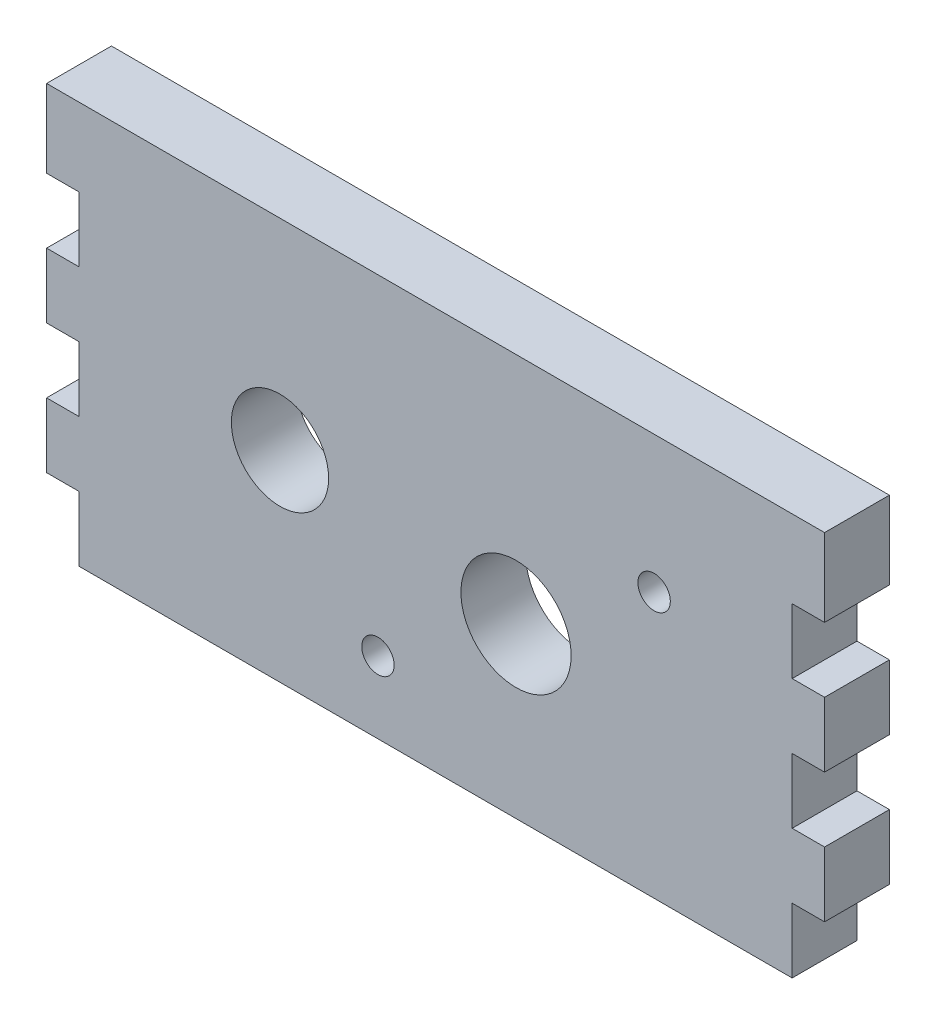
from build123d import *

# Parameters (mm, degrees)
SKETCH_2_W               = 120
SKETCH_2_H               = 62
SKETCH_2_R               = 2.5
SKETCH_2_R_2             = 8.5
SKETCH_2_R_3             = 7.5
EXTRUDE_1_DEPTH          = 10
CUT_EXTRUDE_1_REACH      = 70.272
SKETCH_3_W               = 5
SKETCH_3_H               = 10
PATTERN_LINEAR_1_COUNT   = 3
PATTERN_LINEAR_1_PITCH   = 20
MIRROR_1_COPY_1_REACH    = 70.272
MIRROR_1_COPY_1_SKETCH_W = 5
MIRROR_1_COPY_1_SKETCH_H = 10
MIRROR_1_COPY_2_REACH    = 70.272
MIRROR_1_COPY_2_SKETCH_W = 5
MIRROR_1_COPY_2_SKETCH_H = 10
MIRROR_1_COPY_3_REACH    = 70.272
MIRROR_1_COPY_3_SKETCH_W = 5
MIRROR_1_COPY_3_SKETCH_H = 10


with BuildPart() as part:
    # 스케치2 → 보스-돌출1 (new body)
    with BuildSketch(Plane.XY):
        Rectangle(SKETCH_2_W, SKETCH_2_H)
        with Locations((-8.889677969, -19.912987345)):
            Circle(SKETCH_2_R, mode=Mode.SUBTRACT)
        with Locations((12.408275183, -5)):
            Circle(SKETCH_2_R_2, mode=Mode.SUBTRACT)
        with Locations((-24, 0)):
            Circle(SKETCH_2_R_3, mode=Mode.SUBTRACT)
        with Locations((33.706228335, 9.912987345)):
            Circle(SKETCH_2_R, mode=Mode.SUBTRACT)
    extrude(amount=EXTRUDE_1_DEPTH)

    # 스케치3 → 컷-돌출1 (cut, up to next)
    with BuildSketch(Plane.XY.offset(10), mode=Mode.PRIVATE) as cut_extrude_1_sk1:
        with Locations((-57.5, -26)):
            Rectangle(SKETCH_3_W, SKETCH_3_H)
    cut_extrude_1_tool1 = extrude(cut_extrude_1_sk1.sketch, amount=-CUT_EXTRUDE_1_REACH, mode=Mode.PRIVATE) & part.part
    cut_extrude_1 = cut_extrude_1_tool1.solids().sort_by_distance((-57.5, -26, 10))[0]
    add(cut_extrude_1, mode=Mode.SUBTRACT)

    # 선형 패턴1: 컷-돌출1 ×3
    with Locations(*[(0, i * PATTERN_LINEAR_1_PITCH, 0) for i in range(1, PATTERN_LINEAR_1_COUNT)]):
        add(cut_extrude_1, mode=Mode.SUBTRACT)

    # 대칭 복사1 copy 1 sketch → 대칭 복사1 copy 1 (cut, up to next)
    with BuildSketch(Plane(origin=(0, 20, 10), x_dir=(-1, 0, 0), z_dir=(0, 0, 1)), mode=Mode.PRIVATE) as mirror_1_copy_1_sk1:
        with Locations((-57.5, 26)):
            Rectangle(MIRROR_1_COPY_1_SKETCH_W, MIRROR_1_COPY_1_SKETCH_H)
    mirror_1_copy_1_tool1 = extrude(mirror_1_copy_1_sk1.sketch, amount=-MIRROR_1_COPY_1_REACH, mode=Mode.PRIVATE) & part.part
    add(mirror_1_copy_1_tool1.solids().sort_by_distance((57.5, -6, 10))[0], mode=Mode.SUBTRACT)

    # 대칭 복사1 copy 2 sketch → 대칭 복사1 copy 2 (cut, up to next)
    with BuildSketch(Plane(origin=(0, 40, 10), x_dir=(-1, 0, 0), z_dir=(0, 0, 1)), mode=Mode.PRIVATE) as mirror_1_copy_2_sk1:
        with Locations((-57.5, 26)):
            Rectangle(MIRROR_1_COPY_2_SKETCH_W, MIRROR_1_COPY_2_SKETCH_H)
    mirror_1_copy_2_tool1 = extrude(mirror_1_copy_2_sk1.sketch, amount=-MIRROR_1_COPY_2_REACH, mode=Mode.PRIVATE) & part.part
    add(mirror_1_copy_2_tool1.solids().sort_by_distance((57.5, 14, 10))[0], mode=Mode.SUBTRACT)

    # 대칭 복사1 copy 3 sketch → 대칭 복사1 copy 3 (cut, up to next)
    with BuildSketch(Plane(origin=(0, 0, 10), x_dir=(-1, 0, 0), z_dir=(0, 0, 1)), mode=Mode.PRIVATE) as mirror_1_copy_3_sk1:
        with Locations((-57.5, 26)):
            Rectangle(MIRROR_1_COPY_3_SKETCH_W, MIRROR_1_COPY_3_SKETCH_H)
    mirror_1_copy_3_tool1 = extrude(mirror_1_copy_3_sk1.sketch, amount=-MIRROR_1_COPY_3_REACH, mode=Mode.PRIVATE) & part.part
    add(mirror_1_copy_3_tool1.solids().sort_by_distance((57.5, -26, 10))[0], mode=Mode.SUBTRACT)


solid = part.part
